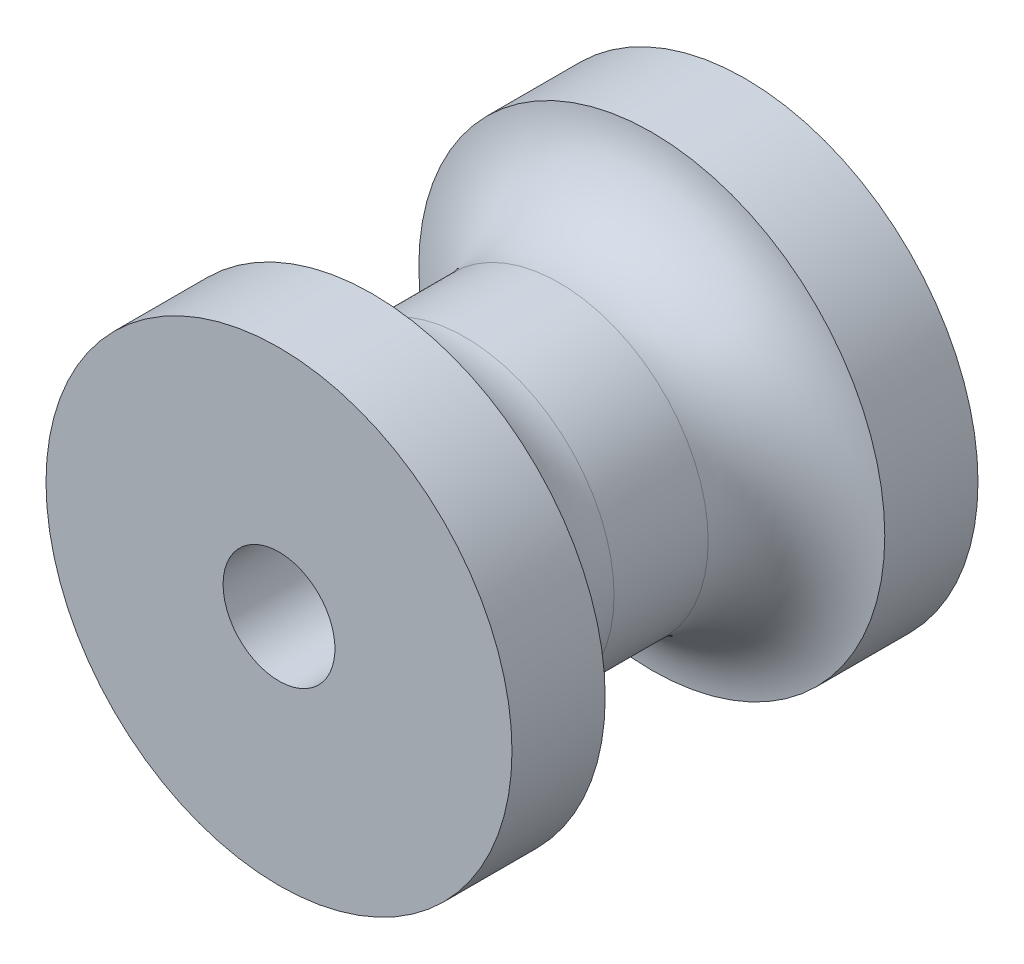
from build123d import *

# Parameters (mm, degrees)
FILLET1_R = 2.54


with BuildPart() as part:
    # Sketch2 → Revolve1 (revolve)
    with BuildSketch(Plane.YZ, mode=Mode.PRIVATE) as revolve1_sk:
        Polygon((6.35, 0), (1.524, 0), (1.524, 12.7), (6.35, 12.7), (6.35, 10.16), (4.064, 10.16), (4.064, 2.54), (6.35, 2.54), align=None)
    revolve(revolve1_sk.sketch.rotate(Axis((0, 0, 0), (0, 0, 1)), 90), axis=Axis((0, 0, 0), (0, 0, 1)))

    # Fillet1
    # the kernel refuses this fillet: 2.54 mm, written as the material it adds along each edge
    with BuildSketch(Plane(origin=(0, 0, 10.16), x_dir=(-1, 0, 0), z_dir=(0, 1, 0))) as fillet1_piece_1:
        with BuildLine():
            CenterArc((6.604, -2.52726809), FILLET1_R, 95.739170477, 84.260829523)
            Line((4.064, -2.52726809), (4.0132, -2.52726809))
            Line((4.0132, -2.52726809), (4.0132, 0))
            Line((4.0132, 0), (4.064, 0.0508))
            ThreePointArc((4.064, 0.0508), (5.207, 0.0508), (6.34492, 0.050545362))
            Line((6.34492, 0.050545362), (6.35, 0))
        make_face()
    revolve(axis=Axis((0, 0, 10.16), (0, 0, 1)))
    with BuildSketch(Plane(origin=(0, 0, 2.54), x_dir=(-1, 0, 0), z_dir=(0, 1, 0))) as fillet1_piece_2:
        with BuildLine():
            CenterArc((6.604, 2.52726809), FILLET1_R, 180, 84.260829523)
            Line((6.35, 0), (6.34492, -0.050545362))
            ThreePointArc((6.34492, -0.050545362), (5.207, -0.0508), (4.064, -0.0508))
            Line((4.064, -0.0508), (4.0132, 0))
            Line((4.0132, 0), (4.0132, 2.52726809))
            Line((4.0132, 2.52726809), (4.064, 2.52726809))
        make_face()
    revolve(axis=Axis((0, 0, 2.54), (0, 0, 1)))


solid = part.part
